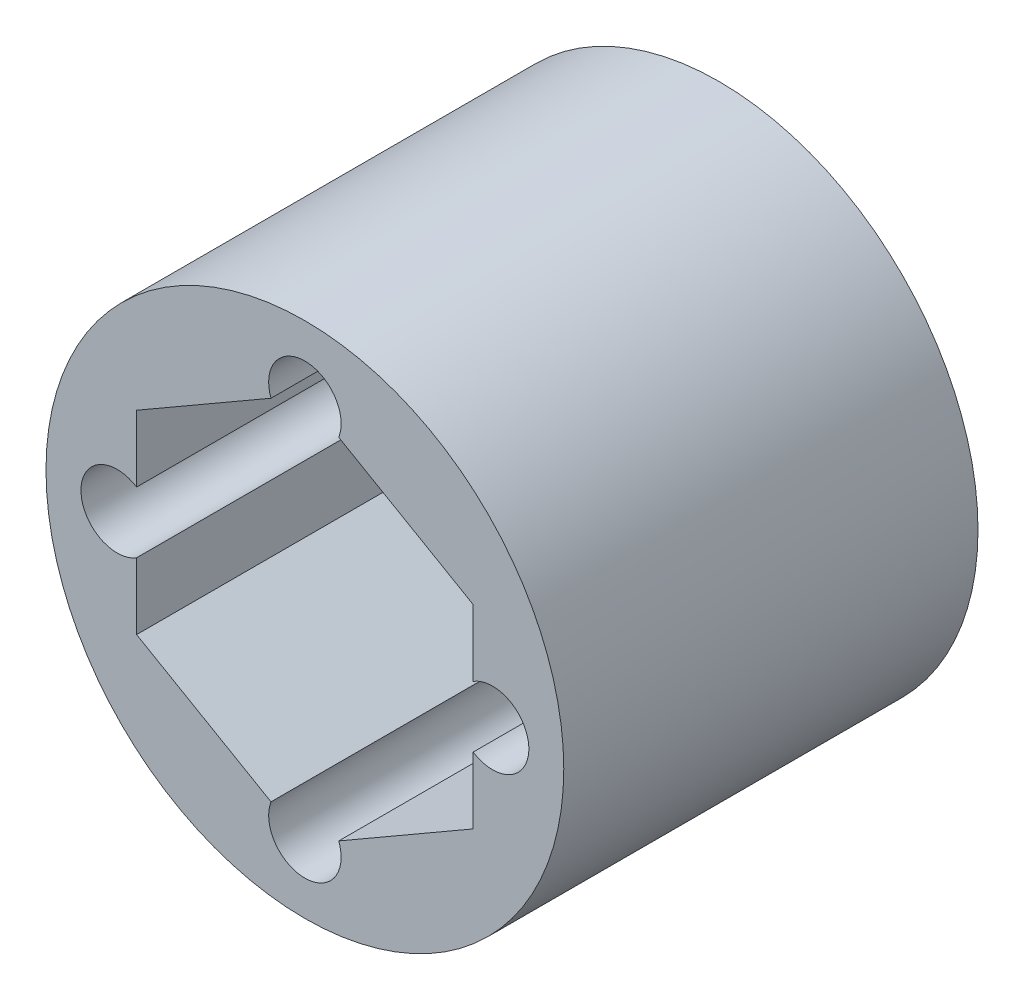
from build123d import *

# Parameters (mm, degrees)
SKETCH1_R           = 10
SKETCH1_R_2         = 1.4
SKETCH1_R_3         = 4.25
BOSS_EXTRUDE1_DEPTH = 16
CUT_EXTRUDE1_DEPTH  = 14


with BuildPart() as part:
    # Sketch1 → Boss-Extrude1 (new body)
    with BuildSketch(Plane.XY):
        Circle(SKETCH1_R)
        with Locations((0, 7.25)):
            Circle(SKETCH1_R_2, mode=Mode.SUBTRACT)
        Circle(SKETCH1_R_3, mode=Mode.SUBTRACT)
        with Locations((7.25, 0)):
            Circle(SKETCH1_R_2, mode=Mode.SUBTRACT)
        with Locations((0, -7.25)):
            Circle(SKETCH1_R_2, mode=Mode.SUBTRACT)
        with Locations((-7.25, 0)):
            Circle(SKETCH1_R_2, mode=Mode.SUBTRACT)
    extrude(amount=BOSS_EXTRUDE1_DEPTH)

    # Sketch2 → Cut-Extrude1 (cut)
    with BuildSketch(Plane.XY.offset(16)):
        Polygon((0, 7.505553499), (-6.5, 3.75277675), (-6.5, -3.75277675), (0, -7.505553499), (6.5, -3.75277675), (6.5, 3.75277675), align=None)
    extrude(amount=-CUT_EXTRUDE1_DEPTH, mode=Mode.SUBTRACT)


solid = part.part
